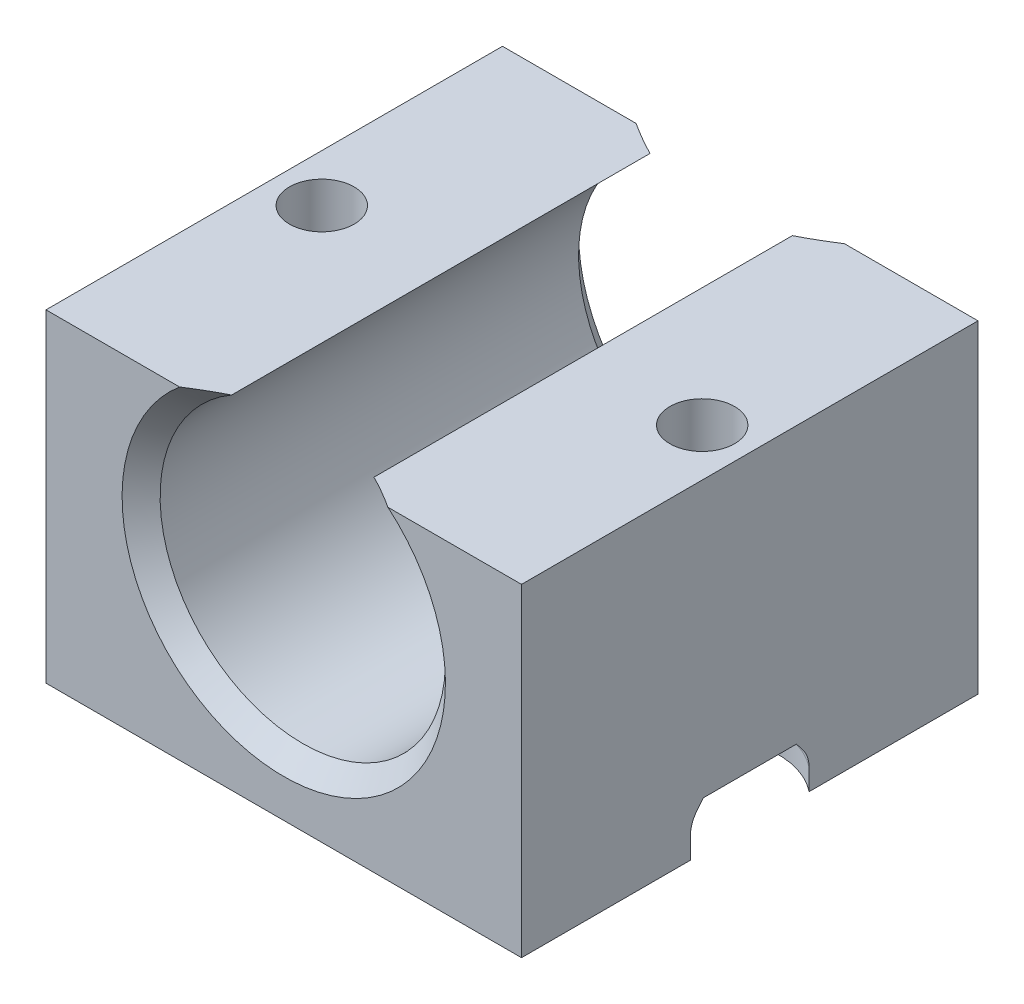
from build123d import *
from OCP.BRepFilletAPI import BRepFilletAPI_MakeChamfer

# Parameters (mm, degrees)
SKETCH1_W                  = 25
SKETCH1_H                  = 24
BOSS_EXTRUDE1_DEPTH        = 17
CUT_EXTRUDE1_START         = -24
CUT_EXTRUDE1_DEPTH         = 24
F_3_4_3_4_DIAMETER_HOLE1_D = 3.4
SKETCH5_R                  = 4
CUT_EXTRUDE2_DEPTH         = 2.5
CHAMFER1_SIZE              = 1
CHAMFER2_SIZE              = 0.5
CHAMFER2_SIZE2             = 0.866025404
FILLET1_R                  = 2


# Read off the part's stored shape, not the designer's step: Cut-Extrude1
with BuildPart() as part:
    # Sketch1 → Boss-Extrude1 (new body)
    with BuildSketch(Plane(origin=(0, 0, 0), x_dir=(1, 0, 0), z_dir=(0, 1, 0))):
        with Locations((12.5, 12)):
            Rectangle(SKETCH1_W, SKETCH1_H)
    extrude(amount=BOSS_EXTRUDE1_DEPTH)

    # Cut-Extrude1 outline → Cut-Extrude1 (cut)
    with BuildSketch(Plane.XY.offset(CUT_EXTRUDE1_START)):
        with BuildLine():
            ThreePointArc((8.758342613, 17), (12.5, 3), (16.241657387, 17))
            Line((16.241657387, 17), (8.758342613, 17))
        make_face()
    extrude(amount=CUT_EXTRUDE1_DEPTH, mode=Mode.SUBTRACT)

    # Ø3.4 (3.4) Diameter Hole1 (through all)
    with Locations(Plane(origin=(0, 17, 0), x_dir=(1, 0, 0), z_dir=(0, 1, 0))):
        with Locations((22.5, 12), (2.5, 12)):
            Hole(F_3_4_3_4_DIAMETER_HOLE1_D / 2)

    # Sketch5 → Cut-Extrude2 (cut)
    with BuildSketch(Plane.XZ):
        with Locations((2.5, -12)):
            Circle(SKETCH5_R)
        with Locations((22.5, -12)):
            Circle(SKETCH5_R)
    extrude(amount=-CUT_EXTRUDE2_DEPTH, mode=Mode.SUBTRACT)

    # Chamfer1
    chamfer1_edges = [part.edges().sort_by_distance(p)[0] for p in [
        (12.5, 3, 0),
        (12.5, 3, -24),
    ]]
    chamfer(chamfer1_edges, length=CHAMFER1_SIZE)

    # Chamfer2: one chamfer whose edges measure the first distance from different faces: ONE call of the kernel's chamfer builder (chamfer() names one face for all edges)
    chamfer2_edges_1 = [part.edges().sort_by_distance(p)[0] for p in [
        (6.5, 2.5, -12),
    ]]
    chamfer2_side_1 = [part.faces().sort_by_distance(p)[0] for p in [
        (0.103077641, 2.5, -12),
    ]]
    chamfer2_edges_2 = [part.edges().sort_by_distance(p)[0] for p in [
        (18.5, 2.5, -12),
    ]]
    chamfer2_side_2 = [part.faces().sort_by_distance(p)[0] for p in [
        (24.896922359, 2.5, -12),
    ]]
    chamfer2 = BRepFilletAPI_MakeChamfer(part.part.solid().wrapped)
    for e in chamfer2_edges_1:
        chamfer2.Add(CHAMFER2_SIZE, CHAMFER2_SIZE2, e.wrapped, chamfer2_side_1[0].wrapped)  # the first distance lies on this face
    for e in chamfer2_edges_2:
        chamfer2.Add(CHAMFER2_SIZE, CHAMFER2_SIZE2, e.wrapped, chamfer2_side_2[0].wrapped)  # the first distance lies on this face
    add(Compound.cast(chamfer2.Shape()), mode=Mode.REPLACE)

    # Fillet1
    fillet1_edges = [part.edges().sort_by_distance(p)[0] for p in [
        (6.5, 1.633974596, -12),
        (18.5, 1.633974596, -12),
    ]]
    fillet(fillet1_edges, radius=FILLET1_R)


solid = part.part
